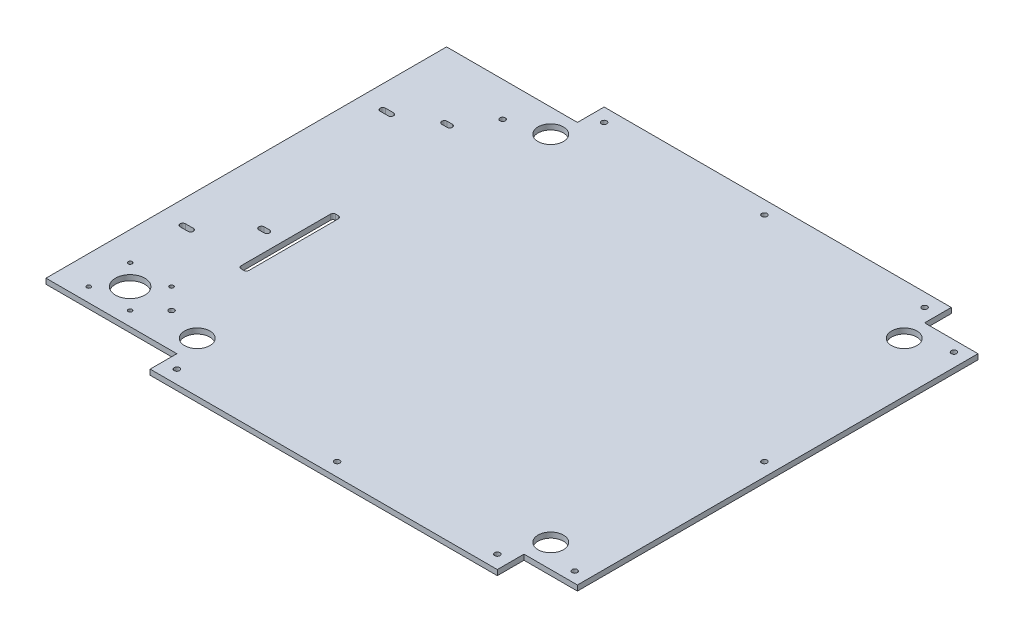
from build123d import *

# Parameters (mm, degrees)
SKETCH1_4_R         = 2
SKETCH1_4_R_2       = 9.5
SKETCH1_4_R_3       = 1.5
SKETCH1_4_R_4       = 11
BOSS_EXTRUDE3_DEPTH = 4


with BuildPart() as part:
    # Sketch1<4> → Boss-Extrude3 (new body)
    with BuildSketch(Plane(origin=(0, 0, 0), x_dir=(1, 0, 0), z_dir=(0, 1, 0))):
        Polygon((130, -150), (170, -150), (170, 150), (130, 150), (130, 170), (-130, 170), (-130, 150), (-228, 150), (-228, -150), (-130, -150), (-130, -170), (130, -170), align=None)
        with Locations((160, -142)):
            Circle(SKETCH1_4_R, mode=Mode.SUBTRACT)
        with Locations((160, 0)):
            Circle(SKETCH1_4_R, mode=Mode.SUBTRACT)
        with Locations((160, 142)):
            Circle(SKETCH1_4_R, mode=Mode.SUBTRACT)
        with Locations((132.375, -132.375)):
            Circle(SKETCH1_4_R_2, mode=Mode.SUBTRACT)
        with BuildLine():
            ThreePointArc((-163, -2), (-162.414213562, -0.585786438), (-161, 0))
            Line((-161, 0), (-159, 0))
            ThreePointArc((-159, 0), (-157.585786438, -0.585786438), (-157, -2))
            Line((-157, -2), (-157, -68.911348687))
            ThreePointArc((-157, -68.911348687), (-157.585786438, -70.325562249), (-159, -70.911348687))
            Line((-159, -70.911348687), (-161, -70.911348687))
            ThreePointArc((-161, -70.911348687), (-162.414213562, -70.325562249), (-163, -68.911348687))
            Line((-163, -68.911348687), (-163, -2))
        make_face(mode=Mode.SUBTRACT)
        with Locations((-160, 124)):
            Circle(SKETCH1_4_R, mode=Mode.SUBTRACT)
        with Locations((-160, -124)):
            Circle(SKETCH1_4_R, mode=Mode.SUBTRACT)
        with Locations((132.375, 132.375)):
            Circle(SKETCH1_4_R_2, mode=Mode.SUBTRACT)
        with Locations((0, -160)):
            Circle(SKETCH1_4_R, mode=Mode.SUBTRACT)
        with Locations((120, -160)):
            Circle(SKETCH1_4_R, mode=Mode.SUBTRACT)
        with Locations((-120, -160)):
            Circle(SKETCH1_4_R, mode=Mode.SUBTRACT)
        with Locations((-206.5, -108.5)):
            Circle(SKETCH1_4_R_3, mode=Mode.SUBTRACT)
        with Locations((-175.5, -108.5)):
            Circle(SKETCH1_4_R_3, mode=Mode.SUBTRACT)
        with Locations((-206.5, -139.5)):
            Circle(SKETCH1_4_R_3, mode=Mode.SUBTRACT)
        with Locations((-175.5, -139.5)):
            Circle(SKETCH1_4_R_3, mode=Mode.SUBTRACT)
        with Locations((-191, -124)):
            Circle(SKETCH1_4_R_4, mode=Mode.SUBTRACT)
        with BuildLine():
            ThreePointArc((-211.1, -66.5), (-213.1, -64.5), (-211.1, -62.5))
            Line((-211.1, -62.5), (-205.1, -62.5))
            ThreePointArc((-205.1, -62.5), (-203.1, -64.5), (-205.1, -66.5))
            Line((-205.1, -66.5), (-211.1, -66.5))
        make_face(mode=Mode.SUBTRACT)
        with BuildLine():
            ThreePointArc((-179.6, -39), (-181.6, -37), (-179.6, -35))
            Line((-179.6, -35), (-175.6, -35))
            ThreePointArc((-175.6, -35), (-173.6, -37), (-175.6, -39))
            Line((-175.6, -39), (-179.6, -39))
        make_face(mode=Mode.SUBTRACT)
        with BuildLine():
            ThreePointArc((-211.1, 83.4), (-213.1, 85.4), (-211.1, 87.4))
            Line((-211.1, 87.4), (-205.1, 87.4))
            ThreePointArc((-205.1, 87.4), (-203.1, 85.4), (-205.1, 83.4))
            Line((-205.1, 83.4), (-211.1, 83.4))
        make_face(mode=Mode.SUBTRACT)
        with BuildLine():
            ThreePointArc((-179.6, 98), (-181.6, 100), (-179.6, 102))
            Line((-179.6, 102), (-175.6, 102))
            ThreePointArc((-175.6, 102), (-173.6, 100), (-175.6, 98))
            Line((-175.6, 98), (-179.6, 98))
        make_face(mode=Mode.SUBTRACT)
        with Locations((0, 160)):
            Circle(SKETCH1_4_R, mode=Mode.SUBTRACT)
        with Locations((120, 160)):
            Circle(SKETCH1_4_R, mode=Mode.SUBTRACT)
        with Locations((-120, 160)):
            Circle(SKETCH1_4_R, mode=Mode.SUBTRACT)
        with Locations((-132.375, 132.375)):
            Circle(SKETCH1_4_R_2, mode=Mode.SUBTRACT)
        with Locations((-132.375, -132.375)):
            Circle(SKETCH1_4_R_2, mode=Mode.SUBTRACT)
    extrude(amount=BOSS_EXTRUDE3_DEPTH)


solid = part.part
